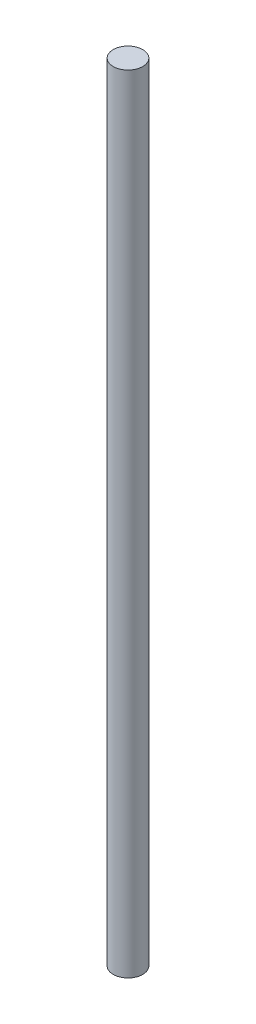
from build123d import *

# Parameters (mm, degrees)
SKETCH1_R           = 1.5
BOSS_EXTRUDE1_DEPTH = 80


with BuildPart() as part:
    # Sketch1 → Boss-Extrude1 (new body)
    with BuildSketch(Plane(origin=(0, 0, 0), x_dir=(1, 0, 0), z_dir=(0, 1, 0))):
        Circle(SKETCH1_R)
    extrude(amount=BOSS_EXTRUDE1_DEPTH)


solid = part.part
